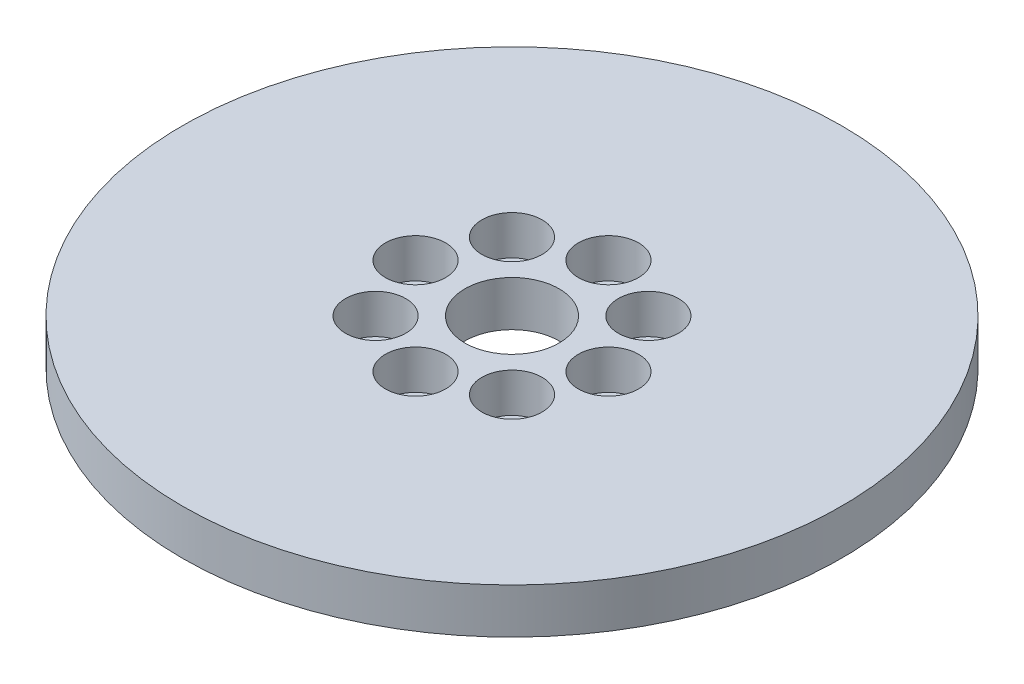
from build123d import *

# Parameters (mm, degrees)
SKETCH1_R           = 87.5
BOSS_EXTRUDE1_DEPTH = 12
SKETCH2_R           = 12.5
CUT_EXTRUDE1_DEPTH  = 125.324173032
SKETCH3_R           = 7.997971968
CUT_EXTRUDE2_DEPTH  = 10.430226508
CIRPATTERN1_COUNT   = 8


with BuildPart() as part:
    # Sketch1 → Boss-Extrude1 (new body)
    with BuildSketch(Plane(origin=(0, 0, 0), x_dir=(1, 0, 0), z_dir=(0, 1, 0))):
        Circle(SKETCH1_R)
    extrude(amount=BOSS_EXTRUDE1_DEPTH)

    # Sketch2 → Cut-Extrude1 (cut, through all)
    with BuildSketch(Plane(origin=(0, 0, 0), x_dir=(1, 0, 0), z_dir=(0, 1, 0))):
        Circle(SKETCH2_R)
    extrude(amount=CUT_EXTRUDE1_DEPTH, mode=Mode.SUBTRACT)

    # Sketch3 → Cut-Extrude2 (cut)
    with BuildSketch(Plane(origin=(0, 12, 0), x_dir=(1, 0, 0), z_dir=(0, 1, 0))):
        with Locations((-25.610408148, 0)):
            Circle(SKETCH3_R)
    cut_extrude2 = extrude(amount=-CUT_EXTRUDE2_DEPTH, mode=Mode.SUBTRACT)

    # CirPattern1: Cut-Extrude2 ×8 about axis
    cirpattern1_axis = Axis((0, 0, 0), (0, 1, 0))
    for i in range(1, CIRPATTERN1_COUNT):
        add(cut_extrude2.rotate(cirpattern1_axis, i * 360 / CIRPATTERN1_COUNT), mode=Mode.SUBTRACT)


solid = part.part
